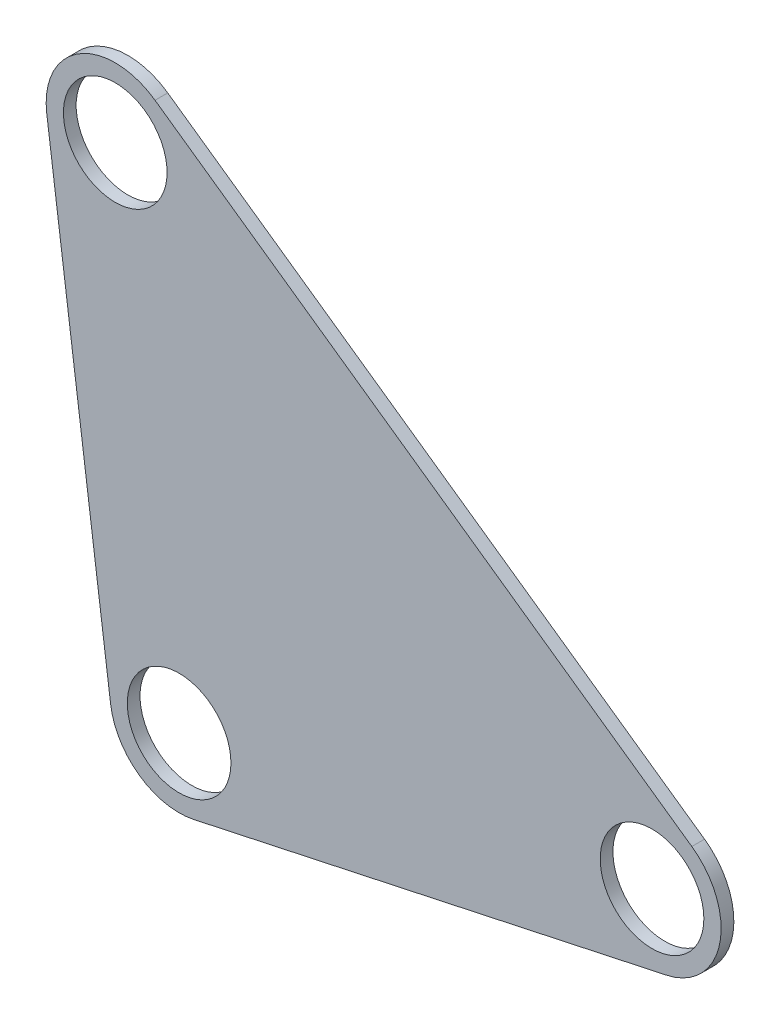
from build123d import *

# Parameters (mm, degrees)
ESQUISSE1_R               = 3
T_LE_DE_BASE_PLI_E1_DEPTH = 0.7366


# Sheet-metal steps are written as plain solids
with BuildPart() as part:
    # Esquisse1 → Tôle de base pliée1 (new body)
    with BuildSketch(Plane.XY):
        with BuildLine():
            Line((32.6051263, -9.780978848), (59.980728888, -3.900810235))
            ThreePointArc((59.980728888, -3.900810235), (63.060247102, -0.788250523), (61.443305942, 3.280774136))
            Line((61.443305942, 3.280774136), (30.370857933, 25.155484984))
            ThreePointArc((30.370857933, 25.155484984), (25.994902612, 25.305403023), (24.103274011, 21.356580209))
            Line((24.103274011, 21.356580209), (27.800119432, -6.398299253))
            ThreePointArc((27.800119432, -6.398299253), (29.46250107, -9.14096248), (32.6051263, -9.780978848))
        make_face()
        with Locations((28.068256791, 21.884700983)):
            Circle(ESQUISSE1_R, mode=Mode.SUBTRACT)
        with Locations((31.765102212, -5.870178479)):
            Circle(ESQUISSE1_R, mode=Mode.SUBTRACT)
        with Locations((59.1407048, 0.009990135)):
            Circle(ESQUISSE1_R, mode=Mode.SUBTRACT)
    extrude(amount=-T_LE_DE_BASE_PLI_E1_DEPTH)


solid = part.part
